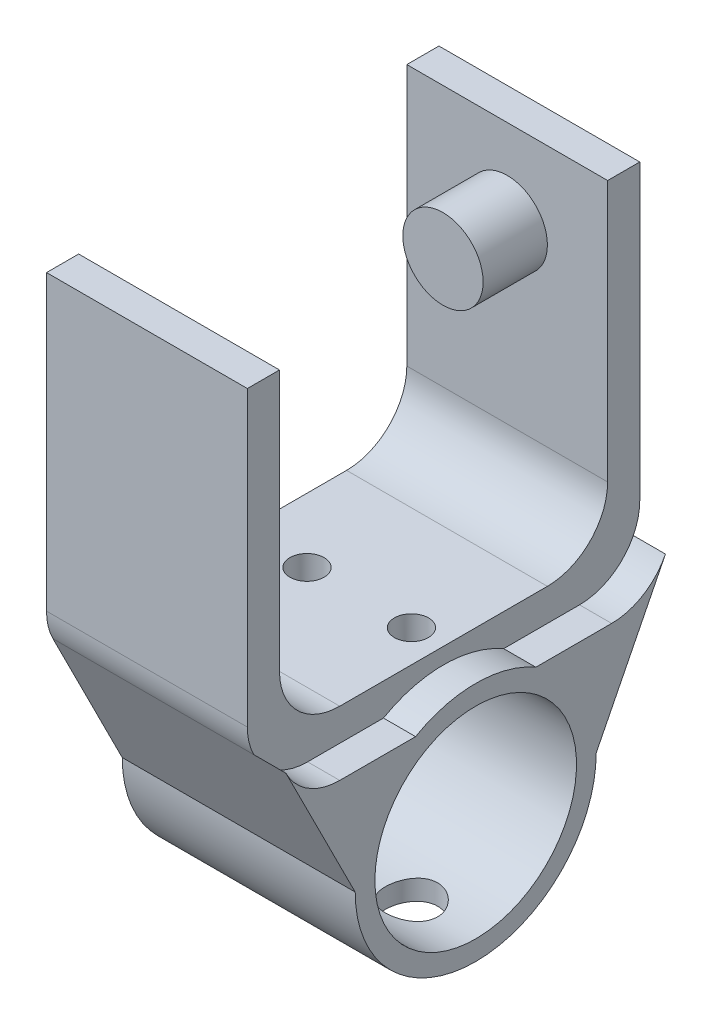
from build123d import *

# Parameters (mm, degrees)
BOSS_EXTRUDE2_DEPTH = 25
SKETCH4_R           = 10
BOSS_EXTRUDE3_DEPTH = 16
FILLET1_R           = 15
SKETCH7_R           = 25.1
BOSS_EXTRUDE4_DEPTH = 58
CUT_EXTRUDE2_REACH  = 160.346
SKETCH8_R           = 6.5
SKETCH10_R          = 4.25
CUT_EXTRUDE3_DEPTH  = 78


with BuildPart() as part:
    # Sketch2 → Boss-Extrude2 (new, symmetric)
    with BuildSketch(Plane(origin=(-11.319139645, 0, 0), x_dir=(0, 0, -1), z_dir=(1, 0, 0))):
        Polygon((-46.939952852, -163.484913433), (-46.939952852, -83.484913433), (-54.939952852, -83.484913433), (-54.939952852, -171.484913433), (42.760047148, -171.484913433), (42.760047148, -83.484913433), (34.760047148, -83.484913433), (34.760047148, -163.484913433), align=None)
    extrude(amount=BOSS_EXTRUDE2_DEPTH, both=True)

    # Sketch4 → Boss-Extrude3 (add)
    with BuildSketch(Plane.XY.offset(-34.760047148)):
        with Locations((-11.319139645, -104.884913433)):
            Circle(SKETCH4_R)
    extrude(amount=BOSS_EXTRUDE3_DEPTH)

    # Fillet1
    fillet1_edges = [part.edges().sort_by_distance(p)[0] for p in [
        (-11.319139645, -171.484913433, -42.760047148),
        (-11.319139645, -171.484913433, 54.939952852),
        (-11.319139645, -163.484913433, -34.760047148),
        (-11.319139645, -163.484913433, 46.939952852),
    ]]
    fillet(fillet1_edges, radius=FILLET1_R)

    # Sketch7 → Boss-Extrude4 (add)
    with BuildSketch(Plane.ZY.offset(36.319139645)):
        with BuildLine():
            Line((36.089952852, -197.484913433), (53.337464568, -163.230777338))
            ThreePointArc((53.337464568, -163.230777338), (47.807990772, -169.25573875), (39.939952852, -171.484913433))
            Line((39.939952852, -171.484913433), (21.056582399, -171.484913433))
            ThreePointArc((21.056582399, -171.484913433), (6.089952852, -167.484913433), (-8.876676695, -171.484913433))
            Line((-8.876676695, -171.484913433), (-27.760047148, -171.484913433))
            ThreePointArc((-27.760047148, -171.484913433), (-35.628085068, -169.25573875), (-41.157558864, -163.230777338))
            Line((-41.157558864, -163.230777338), (-23.910047148, -197.484913433))
            ThreePointArc((-23.910047148, -197.484913433), (6.089952852, -227.484913433), (36.089952852, -197.484913433))
        make_face()
        with Locations((6.089952852, -197.484913433)):
            Circle(SKETCH7_R, mode=Mode.SUBTRACT)
    extrude(amount=-BOSS_EXTRUDE4_DEPTH)

    # Sketch8 → Cut-Extrude2 (cut, up to next)
    with BuildSketch(Plane(origin=(0, -227.484913433, 0), x_dir=(-1, 0, 0), z_dir=(0, -1, 0)), mode=Mode.PRIVATE) as cut_extrude2_sk1:
        with Locations((-5.680860355, -6.089952852)):
            Circle(SKETCH8_R)
    cut_extrude2_tool1 = extrude(cut_extrude2_sk1.sketch, amount=-CUT_EXTRUDE2_REACH, mode=Mode.PRIVATE) & part.part
    # Sketch8 → Cut-Extrude2 (cut, up to next)
    with BuildSketch(Plane(origin=(0, -227.484913433, 0), x_dir=(-1, 0, 0), z_dir=(0, -1, 0)), mode=Mode.PRIVATE) as cut_extrude2_sk2:
        with Locations((20.319139645, -6.089952852)):
            Circle(SKETCH8_R)
    cut_extrude2_tool2 = extrude(cut_extrude2_sk2.sketch, amount=-CUT_EXTRUDE2_REACH, mode=Mode.PRIVATE) & part.part
    add(cut_extrude2_tool1.solids().sort_by_distance((5.68086, -227.484913, 6.089953))[0], mode=Mode.SUBTRACT)
    add(cut_extrude2_tool2.solids().sort_by_distance((-20.31914, -227.484913, 6.089953))[0], mode=Mode.SUBTRACT)

    # Sketch10 → Cut-Extrude3 (cut)
    with BuildSketch(Plane(origin=(0, -227.484913433, 0), x_dir=(-1, 0, 0), z_dir=(0, -1, 0))):
        with Locations((-5.680860355, -6.089952852)):
            Circle(SKETCH10_R)
        with Locations((20.319139645, -6.089952852)):
            Circle(SKETCH10_R)
    extrude(amount=-CUT_EXTRUDE3_DEPTH, mode=Mode.SUBTRACT)


solid = part.part
